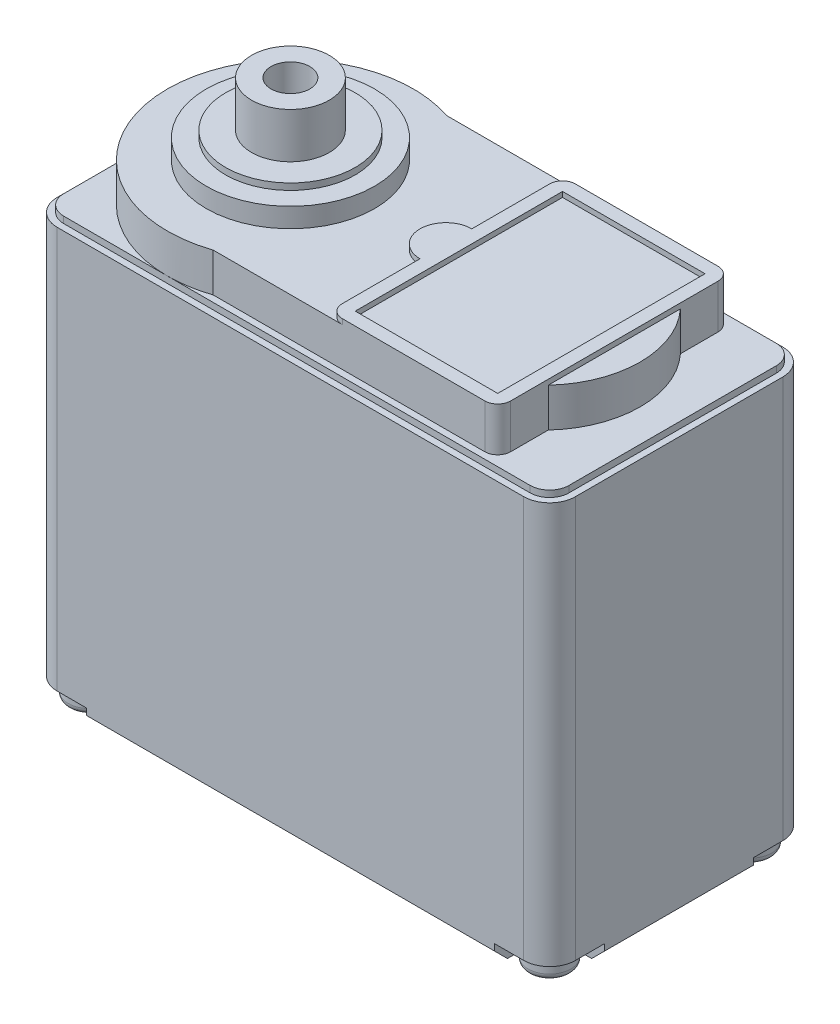
from build123d import *

# Parameters (mm, degrees)
EXTRUDE_1_DEPTH     = 32.5
EXTRUDE_2_DEPTH     = 0.5
CUT_EXTRUDE_1_DEPTH = 1.5
CHAMFER_1_SIZE      = 1
EXTRUDE_3_DEPTH     = 3
SKETCH_5_W          = 11
SKETCH_5_H          = 16
EXTRUDE_4_DEPTH     = 0.4
SKETCH_6_R          = 6.5
EXTRUDE_5_DEPTH     = 1.5
SKETCH_7_R          = 5
EXTRUDE_6_DEPTH     = 0.5
SKETCH_8_R          = 3
SKETCH_8_R_2        = 1.5
EXTRUDE_7_DEPTH     = 3.5
EXTRUDE_8_DEPTH     = 3
SKETCH_12_R         = 1.65
EXTRUDE_11_DEPTH    = 1.5
FILLET_1_R          = 0.5


with BuildPart() as part:
    # Эскиз1 → Бобышка-Вытянуть1 (new body)
    with BuildSketch(Plane(origin=(0, 0, 0), x_dir=(1, 0, 0), z_dir=(0, 1, 0))):
        with BuildLine():
            Line((-18, -10), (18, -10))
            ThreePointArc((18, -10), (19.414213562, -9.414213562), (20, -8))
            Line((20, -8), (20, 8))
            ThreePointArc((20, 8), (19.414213562, 9.414213562), (18, 10))
            Line((18, 10), (-18, 10))
            ThreePointArc((-18, 10), (-19.414213562, 9.414213562), (-20, 8))
            Line((-20, 8), (-20, -8))
            ThreePointArc((-20, -8), (-19.414213562, -9.414213562), (-18, -10))
        make_face()
    extrude(amount=EXTRUDE_1_DEPTH)

    # Эскиз2 → Бобышка-Вытянуть2 (add)
    with BuildSketch(Plane(origin=(0, 32.5, 0), x_dir=(1, 0, 0), z_dir=(0, 1, 0))):
        with BuildLine():
            Line((-18, -9.5), (18, -9.5))
            ThreePointArc((18, -9.5), (19.060660172, -9.060660172), (19.5, -8))
            Line((19.5, -8), (19.5, 8))
            ThreePointArc((19.5, 8), (19.060660172, 9.060660172), (18, 9.5))
            Line((18, 9.5), (-18, 9.5))
            ThreePointArc((-18, 9.5), (-19.060660172, 9.060660172), (-19.5, 8))
            Line((-19.5, 8), (-19.5, -8))
            ThreePointArc((-19.5, -8), (-19.060660172, -9.060660172), (-18, -9.5))
        make_face()
    extrude(amount=EXTRUDE_2_DEPTH)

    # Эскиз3 → Вырез-Вытянуть1 (cut)
    with BuildSketch(Plane.XZ):
        with BuildLine():
            Line((-21.918547291, 5.75), (-17.75, 5.75))
            ThreePointArc((-17.75, 5.75), (-16.335786438, 6.335786438), (-15.75, 7.75))
            Line((-15.75, 7.75), (-15.75, 12.092571755))
            Line((-15.75, 12.092571755), (-21.918547291, 12.092571755))
            Line((-21.918547291, 12.092571755), (-21.918547291, 5.75))
        make_face()
        with BuildLine():
            Line((15.75, 12.092571755), (21.918547291, 12.092571755))
            Line((21.918547291, 12.092571755), (21.918547291, 5.75))
            Line((21.918547291, 5.75), (17.75, 5.75))
            ThreePointArc((17.75, 5.75), (16.335786438, 6.335786438), (15.75, 7.75))
            Line((15.75, 7.75), (15.75, 12.092571755))
        make_face()
        with BuildLine():
            Line((21.918547291, -5.75), (17.75, -5.75))
            ThreePointArc((17.75, -5.75), (16.335786438, -6.335786438), (15.75, -7.75))
            Line((15.75, -7.75), (15.75, -12.092571755))
            Line((15.75, -12.092571755), (21.918547291, -12.092571755))
            Line((21.918547291, -12.092571755), (21.918547291, -5.75))
        make_face()
        with BuildLine():
            Line((-15.75, -12.092571755), (-21.918547291, -12.092571755))
            Line((-21.918547291, -12.092571755), (-21.918547291, -5.75))
            Line((-21.918547291, -5.75), (-17.75, -5.75))
            ThreePointArc((-17.75, -5.75), (-16.335786438, -6.335786438), (-15.75, -7.75))
            Line((-15.75, -7.75), (-15.75, -12.092571755))
        make_face()
    extrude(amount=-CUT_EXTRUDE_1_DEPTH, mode=Mode.SUBTRACT)

    # Фаска1
    chamfer_1_edges = [part.edges().sort_by_distance(p)[0] for p in [
        (-20, 0, 0),
        (0, 0, 10),
        (20, 0, 0),
        (0, 0, -10),
    ]]
    chamfer(chamfer_1_edges, length=CHAMFER_1_SIZE)

    # Эскиз4 → Бобышка-Вытянуть3 (add)
    with BuildSketch(Plane(origin=(0, 33, 0), x_dir=(1, 0, 0), z_dir=(0, 1, 0))):
        with BuildLine():
            Line((15, 8), (15, -8))
            ThreePointArc((15, -8), (14.707106781, -8.707106781), (14, -9))
            Line((14, -9), (-6.958618735, -9))
            ThreePointArc((-6.958618735, -9), (-19.5, 0), (-6.958618735, 9))
            Line((-6.958618735, 9), (14, 9))
            ThreePointArc((14, 9), (14.707106781, 8.707106781), (15, 8))
        make_face()
    extrude(amount=EXTRUDE_3_DEPTH)

    # Эскиз5 → Бобышка-Вытянуть4 (add)
    # profile 1 of 2: a face of its own
    with BuildSketch(Plane(origin=(0, 36, 0), x_dir=(1, 0, 0), z_dir=(0, 1, 0))):
        with BuildLine():
            ThreePointArc((2, 2), (0, 0), (2, -2))
            Line((2, -2), (2, 2))
        make_face()
    # profile 2 of 2: a face of its own
    with BuildSketch(Plane(origin=(0, 36, 0), x_dir=(1, 0, 0), z_dir=(0, 1, 0))):
        with BuildLine():
            ThreePointArc((14, -9), (14.707106781, -8.707106781), (15, -8))
            Line((15, -8), (15, 8))
            ThreePointArc((15, 8), (14.707106781, 8.707106781), (14, 9))
            Line((14, 9), (3, 9))
            ThreePointArc((3, 9), (2.292893219, 8.707106781), (2, 8))
            Line((2, 8), (2, 2))
            Line((2, 2), (2, -2))
            Line((2, -2), (2, -8))
            ThreePointArc((2, -8), (2.292893219, -8.707106781), (3, -9))
            Line((3, -9), (14, -9))
        make_face()
        with Locations((8.5, 0)):
            Rectangle(SKETCH_5_W, SKETCH_5_H, mode=Mode.SUBTRACT)
    extrude(amount=EXTRUDE_4_DEPTH)

    # Эскиз6 → Бобышка-Вытянуть5 (add)
    with BuildSketch(Plane(origin=(0, 36, 0), x_dir=(1, 0, 0), z_dir=(0, 1, 0))):
        with Locations(Location((-10, 0, 0), (0, 0, 270))):
            Circle(SKETCH_6_R)
    extrude(amount=EXTRUDE_5_DEPTH)

    # Эскиз7 → Бобышка-Вытянуть6 (add)
    with BuildSketch(Plane(origin=(0, 37.5, 0), x_dir=(1, 0, 0), z_dir=(0, 1, 0))):
        with Locations(Location((-10, 0, 0), (0, 0, 270))):
            Circle(SKETCH_7_R)
    extrude(amount=EXTRUDE_6_DEPTH)

    # Эскиз8 → Бобышка-Вытянуть7 (add)
    with BuildSketch(Plane(origin=(0, 38, 0), x_dir=(1, 0, 0), z_dir=(0, 1, 0))):
        with Locations(Location((-10, 0, 0), (0, 0, 270))):
            Circle(SKETCH_8_R)
        with Locations(Location((-10, 0, 0), (0, 0, 270))):
            Circle(SKETCH_8_R_2, mode=Mode.SUBTRACT)
    extrude(amount=EXTRUDE_7_DEPTH)

    # Эскиз9 → Бобышка-Вытянуть8 (add)
    with BuildSketch(Plane(origin=(0, 33, 0), x_dir=(1, 0, 0), z_dir=(0, 1, 0))):
        with BuildLine():
            Line((14.5, 5.590169944), (14.5, -5.590169944))
            ThreePointArc((14.5, -5.590169944), (17, 0), (14.5, 5.590169944))
        make_face()
    extrude(amount=EXTRUDE_8_DEPTH)

    # Эскиз12 → Бобышка-Вытянуть11 (add)
    # profile 1 of 4: a face of its own
    with BuildSketch(Plane.XZ.offset(-1.5)):
        with Locations(Location((-17.75, 7.75, 0), (0, 0, 90))):
            Circle(SKETCH_12_R)
        Polygon((-18, 8), (-19, 8), (-19, 7.5), (-18, 7.5), (-18, 6.5), (-17.5, 6.5), (-17.5, 7.5), (-16.5, 7.5), (-16.5, 8), (-17.5, 8), (-17.5, 9), (-18, 9), align=None, mode=Mode.SUBTRACT)
    # profile 2 of 4: a face of its own
    with BuildSketch(Plane.XZ.offset(-1.5)):
        with Locations(Location((17.75, 7.75, 0), (0, 0, 90))):
            Circle(SKETCH_12_R)
        Polygon((16.5, 7.5), (16.5, 8), (17.5, 8), (17.5, 9), (18, 9), (18, 8), (19, 8), (19, 7.5), (18, 7.5), (18, 6.5), (17.5, 6.5), (17.5, 7.5), align=None, mode=Mode.SUBTRACT)
    # profile 3 of 4: a face of its own
    with BuildSketch(Plane.XZ.offset(-1.5)):
        with Locations(Location((17.75, -7.75, 0), (0, 0, 90))):
            Circle(SKETCH_12_R)
        Polygon((16.5, -8), (17.5, -8), (17.5, -9), (18, -9), (18, -8), (19, -8), (19, -7.5), (18, -7.5), (18, -6.5), (17.5, -6.5), (17.5, -7.5), (16.5, -7.5), align=None, mode=Mode.SUBTRACT)
    # profile 4 of 4: a face of its own
    with BuildSketch(Plane.XZ.offset(-1.5)):
        with Locations(Location((-17.75, -7.75, 0), (0, 0, 90))):
            Circle(SKETCH_12_R)
        Polygon((-17.5, -6.5), (-17.5, -7.5), (-16.5, -7.5), (-16.5, -8), (-17.5, -8), (-17.5, -9), (-18, -9), (-18, -8), (-19, -8), (-19, -7.5), (-18, -7.5), (-18, -6.5), align=None, mode=Mode.SUBTRACT)
    extrude(amount=EXTRUDE_11_DEPTH)

    # Скругление1
    # the kernel refuses this fillet: 0.5 mm, written as the material it takes off along each edge
    with BuildSketch(Plane(origin=(17.75, 0, 7.75), x_dir=(0, 0, 1), z_dir=(1, 0, 0))) as fillet_1_piece_1:
        with BuildLine():
            CenterArc((1.65 - FILLET_1_R, -FILLET_1_R), FILLET_1_R, 0, 90)
            Line((1.65 - FILLET_1_R, 0), (1.65, 0))
            Line((1.65, 0), (1.65, -FILLET_1_R))
        make_face()
    revolve(axis=Axis((17.75, 0, 7.75), (0, -1, 0)), mode=Mode.SUBTRACT)
    with BuildSketch(Plane(origin=(17.75, 0, -7.75), x_dir=(0, 0, 1), z_dir=(1, 0, 0))) as fillet_1_piece_2:
        with BuildLine():
            CenterArc((1.65 - FILLET_1_R, -FILLET_1_R), FILLET_1_R, 0, 90)
            Line((1.65 - FILLET_1_R, 0), (1.65, 0))
            Line((1.65, 0), (1.65, -FILLET_1_R))
        make_face()
    revolve(axis=Axis((17.75, 0, -7.75), (0, -1, 0)), mode=Mode.SUBTRACT)
    with BuildSketch(Plane(origin=(-17.75, 0, -7.75), x_dir=(0, 0, 1), z_dir=(1, 0, 0))) as fillet_1_piece_3:
        with BuildLine():
            CenterArc((1.65 - FILLET_1_R, -FILLET_1_R), FILLET_1_R, 0, 90)
            Line((1.65 - FILLET_1_R, 0), (1.65, 0))
            Line((1.65, 0), (1.65, -FILLET_1_R))
        make_face()
    revolve(axis=Axis((-17.75, 0, -7.75), (0, -1, 0)), mode=Mode.SUBTRACT)
    with BuildSketch(Plane(origin=(-17.75, 0, 7.75), x_dir=(0, 0, 1), z_dir=(1, 0, 0))) as fillet_1_piece_4:
        with BuildLine():
            CenterArc((1.65 - FILLET_1_R, -FILLET_1_R), FILLET_1_R, 0, 90)
            Line((1.65 - FILLET_1_R, 0), (1.65, 0))
            Line((1.65, 0), (1.65, -FILLET_1_R))
        make_face()
    revolve(axis=Axis((-17.75, 0, 7.75), (0, -1, 0)), mode=Mode.SUBTRACT)


solid = part.part
